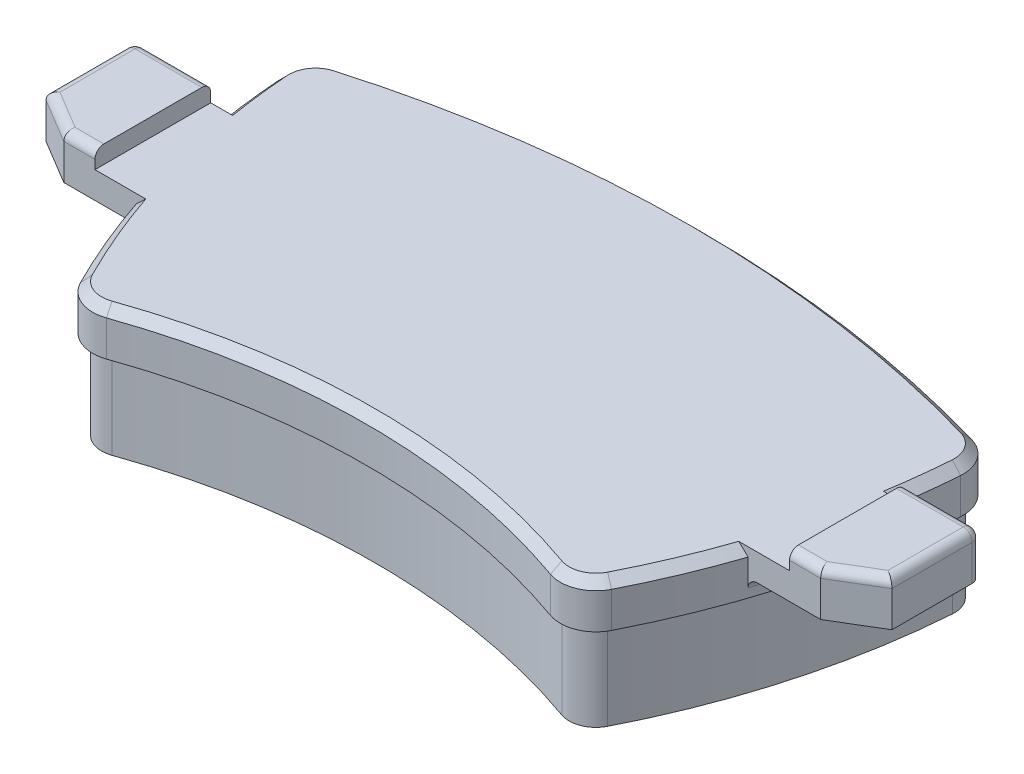
from build123d import *

# Parameters (mm, degrees)
DODANIE_WYCI_GNI_CIE2_DEPTH      = 10
DODANIE_WYCI_GNI_CIE3_DEPTH      = 5
DODANIE_WYCI_GNI_CIE4_DEPTH      = 2
DODANIE_WYCI_GNI_CIE4_DEPTH_BACK = 3
SFAZOWANIE2_SIZE                 = 1
ZAOKR_GLENIE2_R                  = 1
SZKIC5_W                         = 78
SZKIC5_H                         = 47.399243566
WYTNIJ_WYCI_GNI_CIE1_DEPTH       = 10


with BuildPart() as part:
    # Szkic1 → Dodanie-wyciągnięcie2 (new body)
    with BuildSketch(Plane(origin=(0, 0, 0), x_dir=(1, 0, 0), z_dir=(0, 1, 0))):
        with BuildLine():
            ThreePointArc((-35.198290521, 18.220532858), (0, 23.195615958), (35.198290521, 18.220532858))
            ThreePointArc((35.198290521, 18.220532858), (36.828860435, 17.052239434), (37.358722234, 15.117578161))
            ThreePointArc((37.358722234, 15.117578161), (34.64818175, -0.440013395), (28.93215854, -15.161180582))
            ThreePointArc((28.93215854, -15.161180582), (27.37301165, -16.588880533), (25.259425897, -16.633840931))
            ThreePointArc((25.259425897, -16.633840931), (0, -12.31341545), (-25.259425897, -16.633840931))
            ThreePointArc((-25.259425897, -16.633840931), (-27.37301165, -16.588880533), (-28.93215854, -15.161180582))
            ThreePointArc((-28.93215854, -15.161180582), (-34.64818175, -0.440013395), (-37.358722234, 15.117578161))
            ThreePointArc((-37.358722234, 15.117578161), (-36.828860435, 17.052239434), (-35.198290521, 18.220532858))
        make_face()
    extrude(amount=DODANIE_WYCI_GNI_CIE2_DEPTH)

    # Szkic3 → Dodanie-wyciągnięcie3 (add)
    with BuildSketch(Plane(origin=(0, 10, 0), x_dir=(1, 0, 0), z_dir=(0, 1, 0))):
        with BuildLine():
            ThreePointArc((-35.475442415, 19.181358975), (-37.649535634, 17.62363441), (-38.356018032, 15.044086045))
            ThreePointArc((-38.356018032, 15.044086045), (-35.611569929, -0.708123852), (-29.824041887, -15.613446096))
            ThreePointArc((-29.824041887, -15.613446096), (-27.745179368, -17.51704603), (-24.92706503, -17.576993227))
            ThreePointArc((-24.92706503, -17.576993227), (0, -13.31341545), (24.92706503, -17.576993227))
            ThreePointArc((24.92706503, -17.576993227), (27.745179368, -17.51704603), (29.824041887, -15.613446096))
            ThreePointArc((29.824041887, -15.613446096), (35.611569929, -0.708123852), (38.356018032, 15.044086045))
            ThreePointArc((38.356018032, 15.044086045), (37.649535634, 17.62363441), (35.475442415, 19.181358975))
            ThreePointArc((35.475442415, 19.181358975), (0, 24.195615958), (-35.475442415, 19.181358975))
        make_face()
    extrude(amount=DODANIE_WYCI_GNI_CIE3_DEPTH)

    # Szkic4 → Dodanie-wyciągnięcie4 (add, two sides: drawn at the far end of the back side and taken through both)
    with BuildSketch(Plane(origin=(0, 15, 0), x_dir=(1, 0, 0), z_dir=(0, 1, 0)).offset(-DODANIE_WYCI_GNI_CIE4_DEPTH_BACK)):
        with BuildLine():
            Line((-34.353845871, -4.804384042), (-38.327790803, -4.804384042))
            Line((-38.327790803, -4.804384042), (-42.5, -4.804384042))
            Line((-42.5, -4.804384042), (-47.5, -1.804384042))
            Line((-47.5, -1.804384042), (-47.5, 7.195615958))
            ThreePointArc((-47.5, 7.195615958), (-47.207106781, 7.90272274), (-46.5, 8.195615958))
            Line((-46.5, 8.195615958), (-37.556869269, 8.195615958))
            ThreePointArc((-37.556869269, 8.195615958), (-36.224623376, 1.629272522), (-34.353845871, -4.804384042))
        make_face()
        with BuildLine():
            Line((42.5, -4.804384042), (47.5, -1.804384042))
            Line((47.5, -1.804384042), (47.5, 7.195615958))
            ThreePointArc((47.5, 7.195615958), (47.207106781, 7.90272274), (46.5, 8.195615958))
            Line((46.5, 8.195615958), (37.556869269, 8.195615958))
            ThreePointArc((37.556869269, 8.195615958), (36.224623376, 1.629272522), (34.353845871, -4.804384042))
            Line((34.353845871, -4.804384042), (38.327790803, -4.804384042))
            Line((38.327790803, -4.804384042), (42.5, -4.804384042))
        make_face()
    extrude(amount=DODANIE_WYCI_GNI_CIE4_DEPTH + DODANIE_WYCI_GNI_CIE4_DEPTH_BACK)

    # Sfazowanie2
    sfazowanie2_edges = [part.edges().sort_by_distance(p)[0] for p in [
        (0, 15, -24.195615958),
        (-37.649535634, 15, -17.62363441),
        (-38.029401728, 15, -11.611337515),
        (-27.745179368, 15, 17.51704603),
        (0, 15, 13.31341545),
        (27.745179368, 15, 17.51704603),
        (32.284843088, 15, 10.291011463),
        (37.649535634, 15, -17.62363441),
        (38.029401728, 15, -11.611337515),
        (-32.284843088, 15, 10.291011463),
    ]]
    chamfer(sfazowanie2_edges, length=SFAZOWANIE2_SIZE)

    # Zaokrąglenie2
    zaokr_glenie2_edges = [part.edges().sort_by_distance(p)[0] for p in [
        (-36.224623376, 12, -1.629272522),
        (-36.224623376, 15, -1.629272522),
        (-38.426922936, 17, 4.804384042),
        (-45, 17, 3.304384042),
        (-47.5, 17, -2.695615958),
        (-42.028434635, 17, -8.195615958),
        (42.028434635, 17, -8.195615958),
        (47.5, 17, -2.695615958),
        (45, 17, 3.304384042),
        (38.426922936, 17, 4.804384042),
        (36.224623376, 12, -1.629272522),
        (36.224623376, 15, -1.629272522),
        (36.224623376, 17, -1.629272522),
    ]]
    fillet(zaokr_glenie2_edges, radius=ZAOKR_GLENIE2_R - 0.0001)  # a hair under: the kernel refuses the full size

    # Szkic5 → Wytnij-wyciągnięcie1 (cut)
    with BuildSketch(Plane(origin=(0, 15, 0), x_dir=(1, 0, 0), z_dir=(0, 1, 0))):
        with Locations((0, -5.950048289)):
            Rectangle(SZKIC5_W, SZKIC5_H)
    extrude(amount=WYTNIJ_WYCI_GNI_CIE1_DEPTH, mode=Mode.SUBTRACT)


solid = part.part
